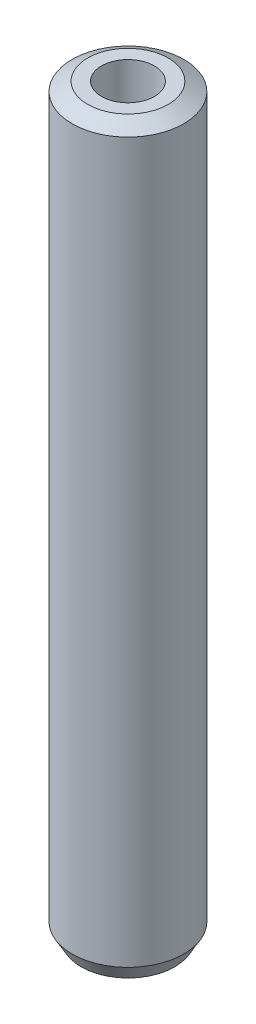
from build123d import *
from OCP.BRepFilletAPI import BRepFilletAPI_MakeChamfer

# Parameters (mm, degrees)
SKETCH1_R           = 20
BOSS_EXTRUDE1_DEPTH = 266.459598619
SKETCH2_R           = 9.491468681
CUT_EXTRUDE1_DEPTH  = 268.956559345
CHAMFER1_SIZE       = 3.222472928
CHAMFER1_SIZE2      = 5.581486837


with BuildPart() as part:
    # Sketch1 → Boss-Extrude1 (new body)
    with BuildSketch(Plane(origin=(0, 0, 0), x_dir=(1, 0, 0), z_dir=(0, 1, 0))):
        Circle(SKETCH1_R)
    extrude(amount=BOSS_EXTRUDE1_DEPTH)

    # Sketch2 → Cut-Extrude1 (cut, through all)
    with BuildSketch(Plane(origin=(0, 0, 0), x_dir=(1, 0, 0), z_dir=(0, 1, 0))):
        Circle(SKETCH2_R)
    extrude(amount=CUT_EXTRUDE1_DEPTH, mode=Mode.SUBTRACT)

    # Chamfer1: one chamfer whose edges measure the first distance from different faces: ONE call of the kernel's chamfer builder (chamfer() names one face for all edges)
    chamfer1_edges_1 = [part.edges().sort_by_distance(p)[0] for p in [
        (-20, 266.459598619, 0),
    ]]
    chamfer1_side_1 = [part.faces().sort_by_distance(p)[0] for p in [
        (-20, 133.229799309, 0),
    ]]
    chamfer1_edges_2 = [part.edges().sort_by_distance(p)[0] for p in [
        (-20, 0, 0),
    ]]
    chamfer1_side_2 = [part.faces().sort_by_distance(p)[0] for p in [
        (-19.434314575, 0, 0),
    ]]
    chamfer1 = BRepFilletAPI_MakeChamfer(part.part.solid().wrapped)
    for e in chamfer1_edges_1:
        chamfer1.Add(CHAMFER1_SIZE, CHAMFER1_SIZE2, e.wrapped, chamfer1_side_1[0].wrapped)  # the first distance lies on this face
    for e in chamfer1_edges_2:
        chamfer1.Add(CHAMFER1_SIZE, CHAMFER1_SIZE2, e.wrapped, chamfer1_side_2[0].wrapped)  # the first distance lies on this face
    add(Compound.cast(chamfer1.Shape()), mode=Mode.REPLACE)


solid = part.part
